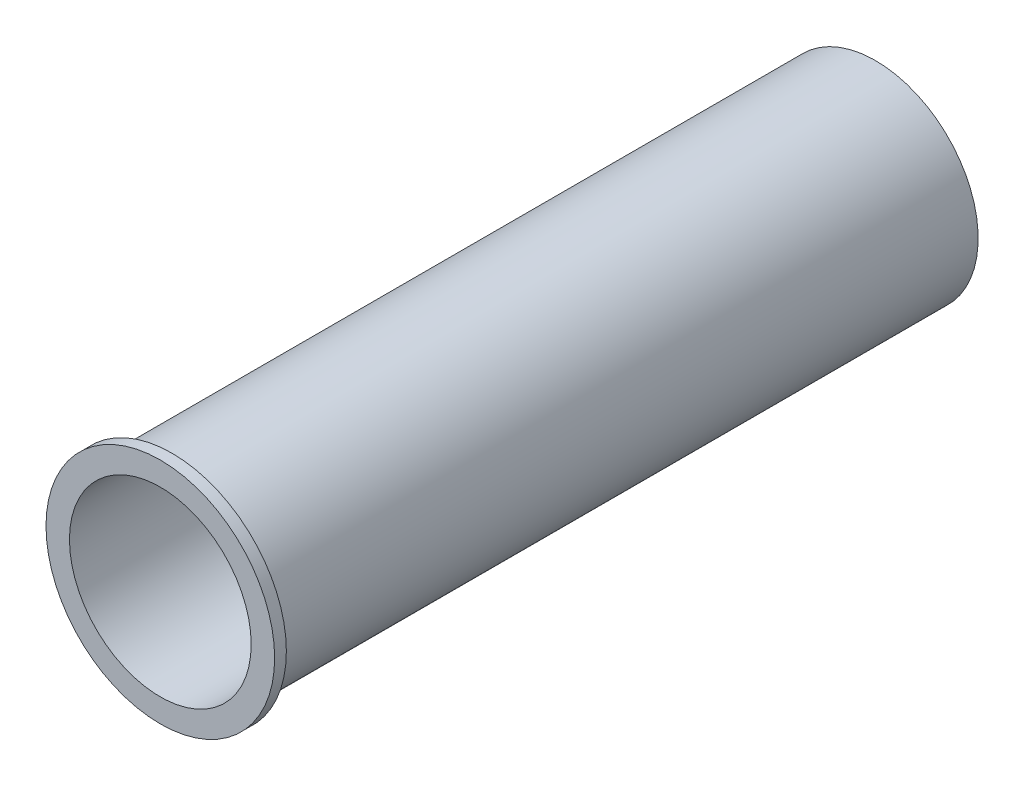
from build123d import *


with BuildPart() as part:
    # Croquis1 → Revolución1 (revolve)
    with BuildSketch(Plane.YZ):
        Polygon((15.5, -60), (15.5, 60), (19.5, 60), (19.5, 58), (17.5, 58), (17.5, -62), (14, -62), (14, -60), align=None)
    revolve(axis=Axis((0, 0, 0), (0, 0, 1)))


solid = part.part
